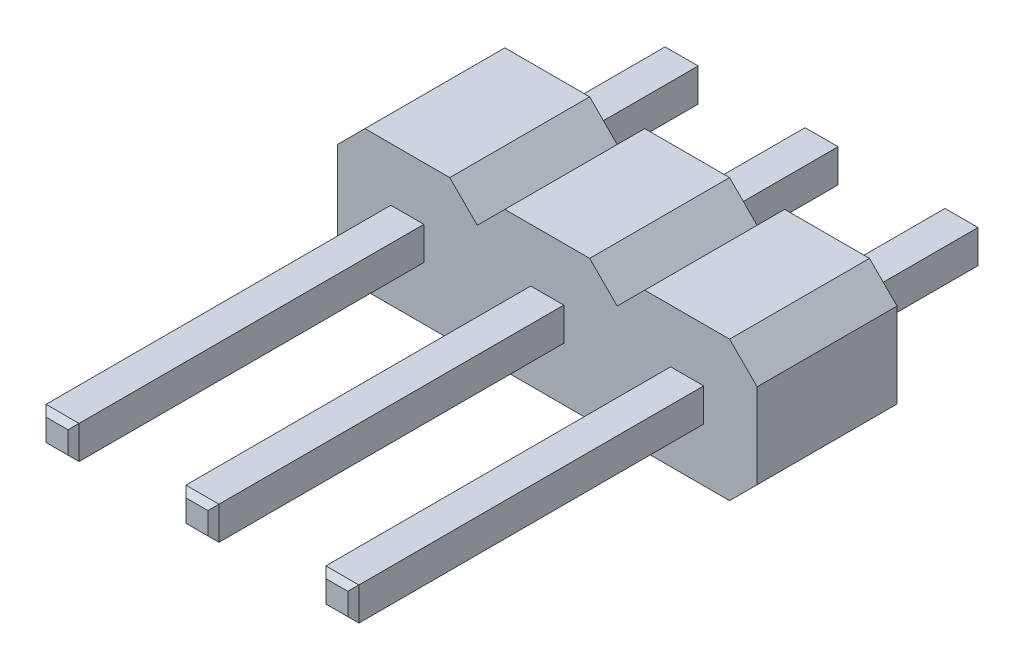
from build123d import *

# Parameters (mm, degrees)
PLASTIC_DEPTH                     = 2.54
SKETCH2_W                         = 11.44
SKETCH2_H                         = 0.6
CONTACT_DEPTH                     = 0.3
CHAMFER1_SIZE                     = 0.1
PATTERN_LINEAR_1_COUNT            = 3
PATTERN_LINEAR_1_PITCH            = 2.54
CHAMFER1_OF_PATTERN_LINEAR_1_SIZE = 0.1


with BuildPart() as part:
    # Sketch1 → Plastic (new body)
    with BuildSketch(Plane.XY):
        Polygon((-0.77, 1.27), (0.77, 1.27), (1.27, 0.77), (1.27, -0.77), (0.77, -1.27), (-0.77, -1.27), (-1.27, -0.77), (-1.27, 0.77), align=None)
    plastic = extrude(amount=PLASTIC_DEPTH)

    # Sketch2 → Contact (add, symmetric)
    with BuildSketch(Plane(origin=(0, 0, 0), x_dir=(0, 0, -1), z_dir=(1, 0, 0))):
        with Locations((-3.18, 0)):
            Rectangle(SKETCH2_W, SKETCH2_H)
    contact = extrude(amount=CONTACT_DEPTH, both=True)

    # Chamfer1
    chamfer1_edges = [part.edges().sort_by_distance(p)[0] for p in [
        (0.3, 0, -2.54),
        (0, -0.3, -2.54),
        (-0.3, 0, -2.54),
        (0, 0.3, -2.54),
        (-0.3, 0, 8.9),
        (0, 0.3, 8.9),
        (0.3, 0, 8.9),
        (0, -0.3, 8.9),
    ]]
    chamfer(chamfer1_edges, length=CHAMFER1_SIZE)

    # Линейный массив1: Plastic, Contact ×3
    with Locations(*[(i * PATTERN_LINEAR_1_PITCH, 0, 0) for i in range(1, PATTERN_LINEAR_1_COUNT)]):
        add(plastic)
        add(contact)

    # Chamfer1 of Линейный массив1
    chamfer1_of_pattern_linear_1_edges = [part.edges().sort_by_distance(p)[0] for p in [
        (2.84, 0, -2.54),
        (2.54, -0.3, -2.54),
        (2.24, 0, -2.54),
        (2.54, 0.3, -2.54),
        (2.24, 0, 8.9),
        (2.54, 0.3, 8.9),
        (2.84, 0, 8.9),
        (2.54, -0.3, 8.9),
        (5.38, 0, -2.54),
        (5.08, -0.3, -2.54),
        (4.78, 0, -2.54),
        (5.08, 0.3, -2.54),
        (4.78, 0, 8.9),
        (5.08, 0.3, 8.9),
        (5.38, 0, 8.9),
        (5.08, -0.3, 8.9),
    ]]
    chamfer(chamfer1_of_pattern_linear_1_edges, length=CHAMFER1_OF_PATTERN_LINEAR_1_SIZE)


solid = part.part
